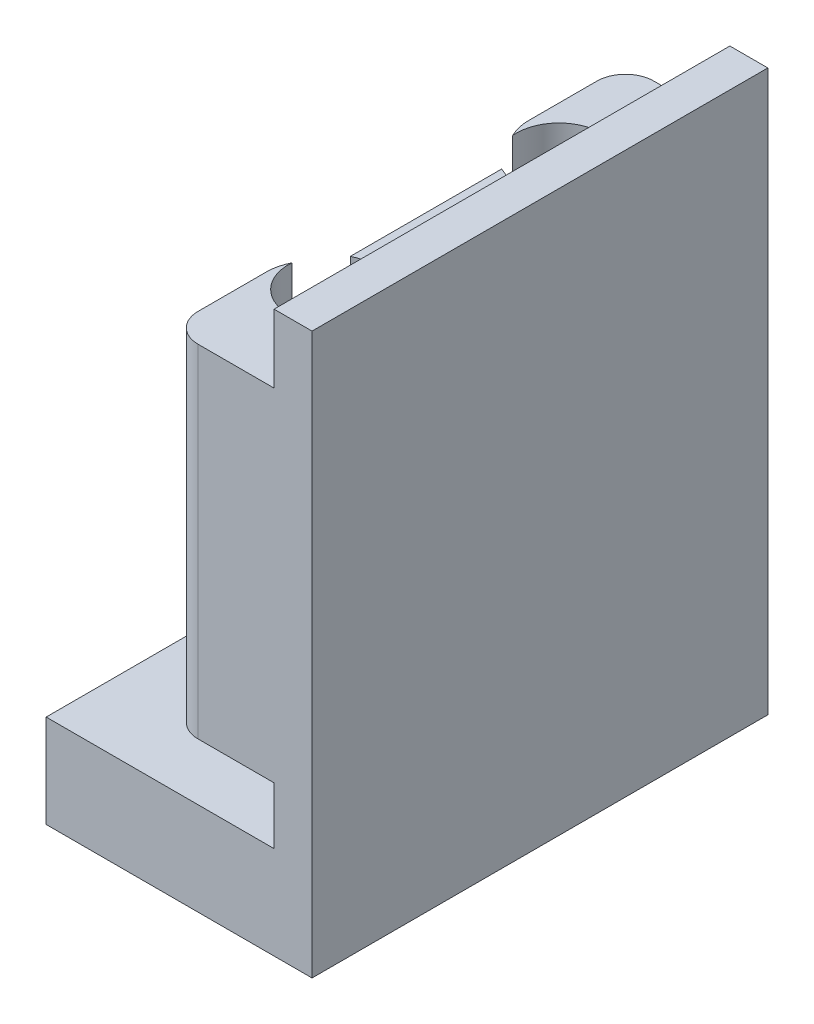
from build123d import *

# Parameters (mm, degrees)
SKETCH1_W           = 12
SKETCH1_H           = 24
BOSS_EXTRUDE1_DEPTH = 4.9
SKETCH2_W           = 2
SKETCH2_H           = 24
BOSS_EXTRUDE2_DEPTH = 29.5
BOSS_EXTRUDE4_START = 3
SKETCH4_W           = 5.5
SKETCH4_H           = 24
BOSS_EXTRUDE4_DEPTH = 18
SKETCH5_W           = 9.25
SKETCH5_H           = 18
CUT_EXTRUDE1_DEPTH  = 1.5
FILLET1_R           = 2.5
SKETCH6_R           = 2.25
CUT_EXTRUDE2_DEPTH  = 30.644729717
FILLET2_R           = 1.5


with BuildPart() as part:
    # Sketch1 → Boss-Extrude1 (new body)
    with BuildSketch(Plane(origin=(0, 0, 0), x_dir=(1, 0, 0), z_dir=(0, 1, 0))):
        Rectangle(SKETCH1_W, SKETCH1_H)
    extrude(amount=BOSS_EXTRUDE1_DEPTH)

    # Sketch2 → Boss-Extrude2 (add)
    with BuildSketch(Plane(origin=(0, 0, 0), x_dir=(1, 0, 0), z_dir=(0, 1, 0))):
        with Locations((7, 0)):
            Rectangle(SKETCH2_W, SKETCH2_H)
    extrude(amount=BOSS_EXTRUDE2_DEPTH)

    # Sketch4 → Boss-Extrude4 (add)
    with BuildSketch(Plane(origin=(0, 4.9, 0), x_dir=(1, 0, 0), z_dir=(0, 1, 0)).offset(BOSS_EXTRUDE4_START)):
        with Locations((3.25, 0)):
            Rectangle(SKETCH4_W, SKETCH4_H)
    extrude(amount=BOSS_EXTRUDE4_DEPTH)

    # Sketch5 → Cut-Extrude1 (cut)
    with BuildSketch(Plane.ZY.offset(-0.5)):
        with Locations((0, 16.9)):
            Rectangle(SKETCH5_W, SKETCH5_H)
    extrude(amount=-CUT_EXTRUDE1_DEPTH, mode=Mode.SUBTRACT)

    # Fillet1
    # the kernel refuses this fillet: 2.5 mm, written as the material it takes off along each edge
    with BuildSketch(Plane(origin=(0.5, 31.628219619, 4.625), x_dir=(0, 0, 1), z_dir=(0, -1, 0)), Plane(origin=(0.5, 7.9, -4.625), x_dir=(0, 0, -1), z_dir=(0, 1, 0))) as fillet1_piece_1:
        with BuildLine():
            CenterArc((2.291287847, -2.5), FILLET1_R, 90, 66.421821522)
            Line((0, -1.5), (0, 0))
            Line((0, 0), (2.291287847, 0))
        make_face()
    extrude(amount=23.728219619, mode=Mode.SUBTRACT)

    # Sketch6 → Cut-Extrude2 (cut, through all)
    with BuildSketch(Plane(origin=(0, 25.9, 0), x_dir=(1, 0, 0), z_dir=(0, 1, 0))):
        with Locations(Location((3, -6, 0), (0, 0, 270))):
            Circle(SKETCH6_R)
        with Locations(Location((3, 6, 0), (0, 0, 270))):
            Circle(SKETCH6_R)
    extrude(amount=-CUT_EXTRUDE2_DEPTH, mode=Mode.SUBTRACT)

    # Fillet2
    fillet2_edges = [part.edges().sort_by_distance(p)[0] for p in [
        (0.5, 16.9, -12),
        (0.5, 16.9, 12),
    ]]
    fillet(fillet2_edges, radius=FILLET2_R)


solid = part.part
